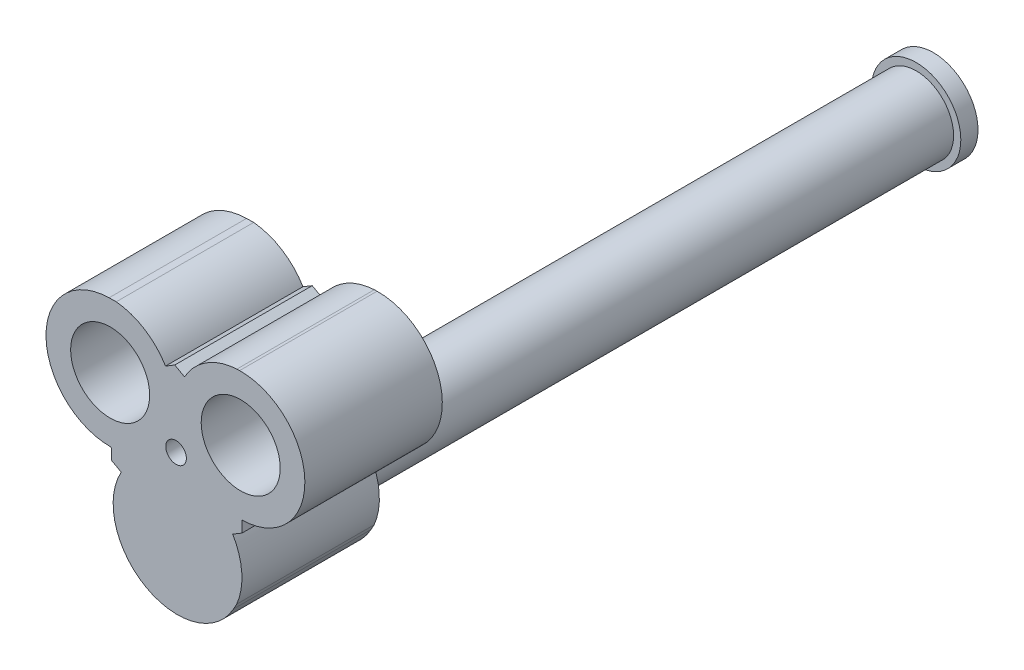
from build123d import *

# Parameters (mm, degrees)
SKETCH1_R           = 6.5
BOSS_EXTRUDE1_DEPTH = 110
SKETCH6_R           = 2.5
BOSS_EXTRUDE2_DEPTH = 2.5
SKETCH7_R           = 2.65
CUT_EXTRUDE1_DEPTH  = 3
SKETCH9_OUTSIDE_W   = 37.798
SKETCH9_OUTSIDE_H   = 37.798
SKETCH9_OUTSIDE_R   = 5.45
CUT_EXTRUDE2_DEPTH  = 107.5
SKETCH10_R          = 5.75
BOSS_EXTRUDE3_DEPTH = 10
JOIN1_START         = 90
JOIN1_OUTLINE_R     = 5.75
JOIN1_OUTLINE_R_2   = 1.5
JOIN1_DEPTH         = 20


# Read off the part's stored shape, not the designer's step: Join1
with BuildPart() as part:
    # Sketch1 → Boss-Extrude1 (new body)
    with BuildSketch(Plane.XY):
        Circle(SKETCH1_R)
    extrude(amount=BOSS_EXTRUDE1_DEPTH)

    # Sketch6 → Boss-Extrude2 (add)
    with BuildSketch(Plane(origin=(0, 0, 0), x_dir=(-1, 0, 0), z_dir=(0, 0, -1))):
        Circle(SKETCH6_R)
    extrude(amount=BOSS_EXTRUDE2_DEPTH)

    # Sketch7 → Cut-Extrude1 (cut)
    with BuildSketch(Plane.XY.offset(110)):
        Circle(SKETCH7_R)
    extrude(amount=-CUT_EXTRUDE1_DEPTH, mode=Mode.SUBTRACT)

    # Sketch9 outside → Cut-Extrude2 (cut)
    with BuildSketch(Plane.XY.offset(110)):
        Rectangle(SKETCH9_OUTSIDE_W, SKETCH9_OUTSIDE_H)
        Circle(SKETCH9_OUTSIDE_R, mode=Mode.SUBTRACT)
    extrude(amount=-CUT_EXTRUDE2_DEPTH, mode=Mode.SUBTRACT)

    # Sketch10 → Boss-Extrude3 (add)
    with BuildSketch(Plane.XY.offset(110)):
        Circle(SKETCH10_R)
    extrude(amount=-BOSS_EXTRUDE3_DEPTH)

    # Join1 outline → Join1 (add)
    with BuildSketch(Plane.XY.offset(JOIN1_START)):
        with BuildLine():
            Line((-9.619925066, 6.956270405), (-9.592077276, 5.322159982))
            Line((-9.592077276, 5.322159982), (-8.170365761, 4.533323955))
            ThreePointArc((-8.170365761, 4.533323955), (-4.533323955, -8.170365761), (8.170365761, -4.533323955))
            Line((8.170365761, -4.533323955), (8.6389607, -3.688779845))
            ThreePointArc((8.6389607, -3.688779845), (9.371491926, 0.643333346), (8.053841212, 4.834705829))
            Line((8.053841212, 4.834705829), (9.405164385, 5.645902605))
            Line((9.405164385, 5.645902605), (9.377316595, 7.280013028))
            ThreePointArc((9.377316595, 7.280013028), (18.552203658, 16.773030292), (9.059186394, 25.947917355))
            Line((9.059186394, 25.947917355), (8.661829886, 25.941145781))
            ThreePointArc((8.661829886, 25.941145781), (4.239851168, 24.521014764), (1.047885733, 21.147289146))
            Line((1.047885733, 21.147289146), (-0.373825781, 21.936125173))
            Line((-0.373825781, 21.936125173), (-1.725148954, 21.124928398))
            ThreePointArc((-1.725148954, 21.124928398), (-4.771249912, 24.237629458), (-8.893805616, 25.641970375))
            Line((-8.893805616, 25.641970375), (-9.938055267, 25.624174732))
            ThreePointArc((-9.938055267, 25.624174732), (-19.11294233, 16.131157468), (-9.619925066, 6.956270405))
        make_face()
        Circle(JOIN1_OUTLINE_R, mode=Mode.SUBTRACT)
        with Locations((-9.778990166, 16.290222568)):
            Circle(JOIN1_OUTLINE_R, mode=Mode.SUBTRACT)
        with Locations((-0.187584514, 11.00747351)):
            Circle(JOIN1_OUTLINE_R_2, mode=Mode.SUBTRACT)
        with Locations((9.218251494, 16.613965192)):
            Circle(JOIN1_OUTLINE_R, mode=Mode.SUBTRACT)
    extrude(amount=JOIN1_DEPTH)


solid = part.part
